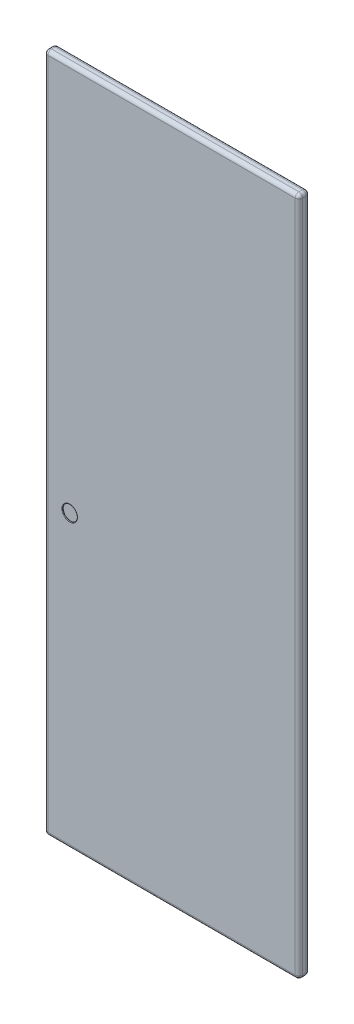
from build123d import *

# Parameters (mm, degrees)
SKETCH1_W           = 700
SKETCH1_H           = 1870
BOSS_EXTRUDE1_DEPTH = 30
SKETCH2_R           = 20
CUT_EXTRUDE1_DEPTH  = 3
SKETCH3_R           = 28
CUT_EXTRUDE2_DEPTH  = 3
FILLET1_R           = 1.5
CUT_EXTRUDE3_START  = -3
SKETCH5_R           = 20
CUT_EXTRUDE3_DEPTH  = 3
CUT_EXTRUDE4_START  = -3
SKETCH6_R           = 28
CUT_EXTRUDE4_DEPTH  = 3
FILLET2_R           = 1.5
FILLET3_R           = 10


with BuildPart() as part:
    # Sketch1 → Boss-Extrude1 (new body)
    with BuildSketch(Plane.XY):
        with Locations((-350, 935)):
            Rectangle(SKETCH1_W, SKETCH1_H)
    extrude(amount=BOSS_EXTRUDE1_DEPTH)

    # Sketch2 → Cut-Extrude1 (cut)
    with BuildSketch(Plane.XY.offset(30)):
        with Locations((-630, 800)):
            Circle(SKETCH2_R)
    extrude(amount=-CUT_EXTRUDE1_DEPTH, mode=Mode.SUBTRACT)

    # Sketch3 → Cut-Extrude2 (cut)
    with BuildSketch(Plane.XY.offset(27)):
        with Locations((-630, 800)):
            Circle(SKETCH3_R)
    extrude(amount=-CUT_EXTRUDE2_DEPTH, mode=Mode.SUBTRACT)

    # Fillet1
    fillet1_edges = [part.edges().sort_by_distance(p)[0] for p in [
        (-650, 800, 30),
        (-650, 800, 27),
    ]]
    fillet(fillet1_edges, radius=FILLET1_R - 0.0001)  # a hair under: the kernel refuses the full size

    # Sketch5 → Cut-Extrude3 (cut)
    with BuildSketch(Plane(origin=(0, 0, 0), x_dir=(-1, 0, 0), z_dir=(0, 0, -1)).offset(CUT_EXTRUDE3_START)):
        with Locations((630, 800)):
            Circle(SKETCH5_R)
    extrude(amount=CUT_EXTRUDE3_DEPTH, mode=Mode.SUBTRACT)

    # Sketch6 → Cut-Extrude4 (cut)
    with BuildSketch(Plane(origin=(0, 0, 3), x_dir=(-1, 0, 0), z_dir=(0, 0, -1)).offset(CUT_EXTRUDE4_START)):
        with Locations(Location((630, 800, 0), (0, 0, 180))):
            Circle(SKETCH6_R)
    extrude(amount=CUT_EXTRUDE4_DEPTH, mode=Mode.SUBTRACT)

    # Fillet2
    fillet2_edges = [part.edges().sort_by_distance(p)[0] for p in [
        (-610, 800, 0),
        (-610, 800, 3),
    ]]
    fillet(fillet2_edges, radius=FILLET2_R - 0.0001)  # a hair under: the kernel refuses the full size

    # Fillet3
    fillet3_edges = [part.edges().sort_by_distance(p)[0] for p in [
        (-700, 935, 30),
        (-350, 0, 30),
        (0, 935, 30),
        (-350, 0, 0),
        (-700, 935, 0),
        (-350, 1870, 0),
        (0, 935, 0),
        (0, 0, 15),
        (-700, 0, 15),
        (-700, 1870, 15),
        (0, 1870, 15),
        (-350, 1870, 30),
    ]]
    fillet(fillet3_edges, radius=FILLET3_R)


solid = part.part
